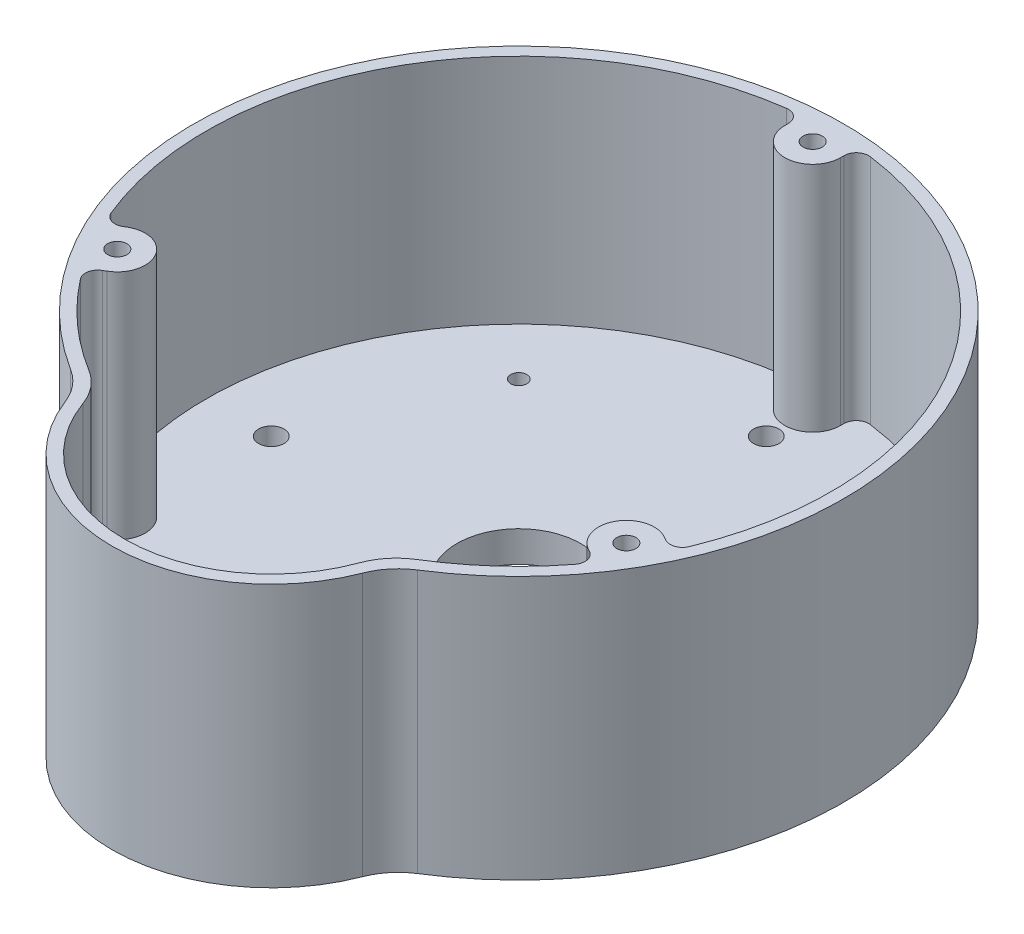
from build123d import *

# Parameters (mm, degrees)
ESQUISSE1_R             = 52.5
ESQUISSE1_R_2           = 2.05
ESQUISSE1_R_3           = 1.3
ESQUISSE1_R_4           = 10
BOSS_EXTRU_2_DEPTH      = 5
ESQUISSE2_R             = 52.5
BOSS_EXTRU_3_DEPTH      = 37.5
ENL_V_START             = -4
ESQUISSE3_R             = 3.35
ENL_V_MAT_EXTRU_1_DEPTH = 82.549693161
ESQUISSE5_R             = 1.55
ENL_V_MAT_EXTRU_3_DEPTH = 86.549693161
ESQUISSE6_R             = 3.75
ENL_V_MAT_EXTRU_4_DEPTH = 3
ESQUISSE7_W             = 50
ESQUISSE7_H             = 37.5
ENL_V_MAT_EXTRU_5_DEPTH = 86.549693161
BOSS_EXTRU_5_DEPTH      = 5
BOSS_EXTRU_9_DEPTH      = 37.5
CONG_1_R                = 10


with BuildPart() as part:
    # Esquisse1 → Boss.-Extru.2 (new body)
    with BuildSketch(Plane(origin=(0, 0, 0), x_dir=(1, 0, 0), z_dir=(0, 1, 0))):
        Circle(ESQUISSE1_R)
        with Locations((0, 40)):
            Circle(ESQUISSE1_R_2, mode=Mode.SUBTRACT)
        with Locations((40, 0)):
            Circle(ESQUISSE1_R_2, mode=Mode.SUBTRACT)
        with Locations((0, -40)):
            Circle(ESQUISSE1_R_2, mode=Mode.SUBTRACT)
        with Locations((-40, 0)):
            Circle(ESQUISSE1_R_2, mode=Mode.SUBTRACT)
        with Locations((28, 28)):
            Circle(ESQUISSE1_R_3, mode=Mode.SUBTRACT)
        with Locations((20, -42)):
            Circle(ESQUISSE1_R_3, mode=Mode.SUBTRACT)
        with Locations((-20, -42)):
            Circle(ESQUISSE1_R_3, mode=Mode.SUBTRACT)
        with Locations((-28, 28)):
            Circle(ESQUISSE1_R_3, mode=Mode.SUBTRACT)
        Circle(ESQUISSE1_R_4, mode=Mode.SUBTRACT)
    extrude(amount=BOSS_EXTRU_2_DEPTH)

    # Esquisse2 → Boss.-Extru.3 (add)
    with BuildSketch(Plane(origin=(0, 5, 0), x_dir=(1, 0, 0), z_dir=(0, 1, 0))):
        Circle(ESQUISSE2_R)
        with BuildLine():
            ThreePointArc((-4.5, 47.5), (0, 43), (4.5, 47.5))
            Line((4.5, 47.5), (4.5, 48.062459363))
            ThreePointArc((4.5, 48.062459363), (5.183960957, 49.568461102), (6.768041237, 50.04441645))
            ThreePointArc((6.768041237, 50.04441645), (43.734282891, 25.25), (46.723756582, -19.16091258))
            ThreePointArc((46.723756582, -19.16091258), (45.519527019, -20.29478867), (43.873310777, -20.134115364))
            Line((43.873310777, -20.134115364), (43.38620668, -19.852885683))
            ThreePointArc((43.38620668, -19.852885683), (37.239092363, -21.5), (38.88620668, -27.647114317))
            Line((38.88620668, -27.647114317), (39.373310777, -27.928343998))
            ThreePointArc((39.373310777, -27.928343998), (40.335566062, -29.273672432), (39.955715345, -30.88350387))
            ThreePointArc((39.955715345, -30.88350387), (0, -50.5), (-39.955715345, -30.88350387))
            ThreePointArc((-39.955715345, -30.88350387), (-40.335566062, -29.273672432), (-39.373310777, -27.928343998))
            Line((-39.373310777, -27.928343998), (-38.88620668, -27.647114317))
            ThreePointArc((-38.88620668, -27.647114317), (-37.239092363, -21.5), (-43.38620668, -19.852885683))
            Line((-43.38620668, -19.852885683), (-43.873310777, -20.134115364))
            ThreePointArc((-43.873310777, -20.134115364), (-45.519527019, -20.29478867), (-46.723756582, -19.16091258))
            ThreePointArc((-46.723756582, -19.16091258), (-43.734282891, 25.25), (-6.768041237, 50.04441645))
            ThreePointArc((-6.768041237, 50.04441645), (-5.183960957, 49.568461102), (-4.5, 48.062459363))
            Line((-4.5, 48.062459363), (-4.5, 47.5))
        make_face(mode=Mode.SUBTRACT)
    extrude(amount=BOSS_EXTRU_3_DEPTH)

    # Esquisse3 → Enlèv. mat.-Extru.1 (cut, through all)
    with BuildSketch(Plane(origin=(0, 42.5, 0), x_dir=(1, 0, 0), z_dir=(0, 1, 0)).offset(ENL_V_START)):
        with Locations((0, 47.5)):
            Circle(ESQUISSE3_R)
        with Locations((41.13620668, -23.75)):
            Circle(ESQUISSE3_R)
        with Locations((-41.13620668, -23.75)):
            Circle(ESQUISSE3_R)
    extrude(amount=-ENL_V_MAT_EXTRU_1_DEPTH, mode=Mode.SUBTRACT)

    # Esquisse5 → Enlèv. mat.-Extru.3 (cut, through all)
    with BuildSketch(Plane(origin=(0, 42.5, 0), x_dir=(1, 0, 0), z_dir=(0, 1, 0))):
        with Locations((0, 47.5)):
            Circle(ESQUISSE5_R)
        with Locations((41.13620668, -23.75)):
            Circle(ESQUISSE5_R)
        with Locations((-41.13620668, -23.75)):
            Circle(ESQUISSE5_R)
    extrude(amount=-ENL_V_MAT_EXTRU_3_DEPTH, mode=Mode.SUBTRACT)

    # Esquisse6 → Enlèv. mat.-Extru.4 (cut)
    with BuildSketch(Plane.XZ):
        with Locations((-20, 42)):
            Circle(ESQUISSE6_R)
        with Locations((20, 42)):
            Circle(ESQUISSE6_R)
        with Locations((-28, -28)):
            Circle(ESQUISSE6_R)
        with Locations((28, -28)):
            Circle(ESQUISSE6_R)
    extrude(amount=-ENL_V_MAT_EXTRU_4_DEPTH, mode=Mode.SUBTRACT)

    # Esquisse7 → Enlèv. mat.-Extru.5 (cut, through all)
    with BuildSketch(Plane.XY):
        with Locations((0, 23.75)):
            Rectangle(ESQUISSE7_W, ESQUISSE7_H)
    extrude(amount=ENL_V_MAT_EXTRU_5_DEPTH, mode=Mode.SUBTRACT)

    # Esquisse8 → Boss.-Extru.5 (add)
    with BuildSketch(Plane(origin=(0, 0, 0), x_dir=(1, 0, 0), z_dir=(0, 1, 0))):
        with BuildLine():
            ThreePointArc((-25, -46.165463282), (0, -65.749037603), (25, -46.165463282))
            ThreePointArc((25, -46.165463282), (0, -52.5), (-25, -46.165463282))
        make_face()
    extrude(amount=BOSS_EXTRU_5_DEPTH)

    # Esquisse11 → Boss.-Extru.9 (add)
    with BuildSketch(Plane(origin=(0, 5, 0), x_dir=(1, 0, 0), z_dir=(0, 1, 0))):
        with BuildLine():
            ThreePointArc((23.2531293, -44.827915162), (0, -63.749037603), (-23.2531293, -44.827915162))
            ThreePointArc((-23.2531293, -44.827915162), (-24.131242464, -44.361392416), (-25, -43.877670859))
            Line((-25, -43.877670859), (-25, -46.165463282))
            ThreePointArc((-25, -46.165463282), (0, -65.749037603), (25, -46.165463282))
            Line((25, -46.165463282), (25, -43.877670859))
            ThreePointArc((25, -43.877670859), (24.131242464, -44.361392416), (23.2531293, -44.827915162))
        make_face()
    extrude(amount=BOSS_EXTRU_9_DEPTH)

    # Congé1
    cong_1_edges = [part.edges().sort_by_distance(p)[0] for p in [
        (-23.2531293, 23.75, 44.827915162),
        (23.2531293, 23.75, 44.827915162),
        (25, 21.25, 46.165463282),
        (-25, 21.25, 46.165463282),
    ]]
    fillet(cong_1_edges, radius=CONG_1_R)


solid = part.part
